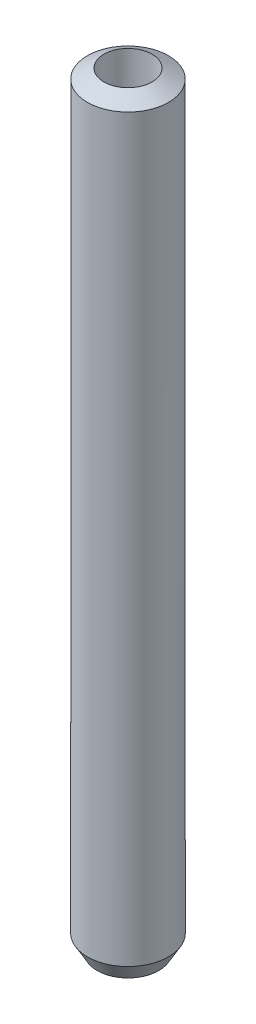
from build123d import *

# Parameters (mm, degrees)
SKETCH1_R           = 7.5
BOSS_EXTRUDE1_DEPTH = 141.884384
SKETCH2_R           = 4.459579484
CUT_EXTRUDE1_DEPTH  = 143.280281217
CHAMFER1_SIZE       = 1.790901
CHAMFER1_SIZE_2     = 3.101931


with BuildPart() as part:
    # Sketch1 → Boss-Extrude1 (new body)
    with BuildSketch(Plane(origin=(0, 0, 0), x_dir=(1, 0, 0), z_dir=(0, 1, 0))):
        with Locations(Location((0, 0, 0), (0, 0, 270))):
            Circle(SKETCH1_R)
    extrude(amount=BOSS_EXTRUDE1_DEPTH)

    # Sketch2 → Cut-Extrude1 (cut, through all)
    with BuildSketch(Plane(origin=(0, 0, 0), x_dir=(1, 0, 0), z_dir=(0, 1, 0))):
        with Locations(Location((0, 0, 0), (0, 0, 270))):
            Circle(SKETCH2_R)
    extrude(amount=CUT_EXTRUDE1_DEPTH, mode=Mode.SUBTRACT)

    # Chamfer1
    # the kernel refuses this chamfer: 3.101931, 1.790901 mm, written as the material it takes off along each edge
    with BuildSketch(Plane(origin=(0, 141.884384, 0), x_dir=(0, 0, 1), z_dir=(-1, 0, 0))) as chamfer1_piece_1:
        Polygon((7.5, -CHAMFER1_SIZE), (7.5 - CHAMFER1_SIZE_2, 0), (7.5, 0), align=None)
    revolve(axis=Axis((0, 141.884384, 0), (0, 1, 0)), mode=Mode.SUBTRACT)
    with BuildSketch(Plane(origin=(0, 0, 0), x_dir=(0, 0, 1), z_dir=(-1, 0, 0))) as chamfer1_piece_2:
        Polygon((7.5, CHAMFER1_SIZE_2), (7.5 - CHAMFER1_SIZE, 0), (7.5, 0), align=None)
    revolve(axis=Axis((0, 0, 0), (0, 1, 0)), mode=Mode.SUBTRACT)


solid = part.part
